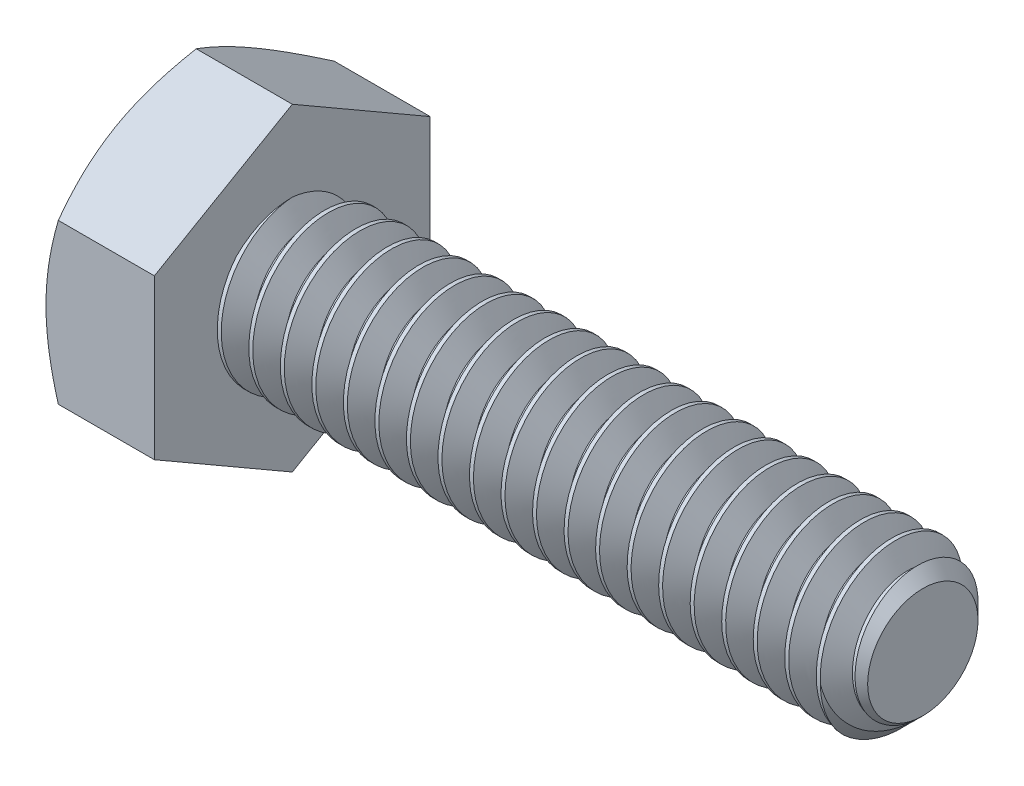
from build123d import *

# Parameters (mm, degrees)
SKETCH5_R           = 3.175
BOSS_EXTRUDE3_DEPTH = 25.4
CHAMFER1_SIZE       = 0.9525
CUT_SWEEP1_PITCH    = 1.27
BOSS_EXTRUDE4_DEPTH = 4.365625
SKETCH8_OUTSIDE_W   = 130.65
SKETCH8_OUTSIDE_H   = 132.37
SKETCH8_OUTSIDE_R   = 5.55625
CUT_EXTRUDE3_DEPTH  = 31.952009727
CUT_EXTRUDE3_DRAFT  = -60
CUT_EXTRUDE4_DEPTH  = 0.254
CIRPATTERN1_COUNT   = 6


with BuildPart() as part:
    # Sketch5 → Boss-Extrude3 (new body)
    with BuildSketch(Plane(origin=(14.8828125, 0, 0), x_dir=(0, 0, -1), z_dir=(1, 0, 0))):
        Circle(SKETCH5_R)
    extrude(amount=-BOSS_EXTRUDE3_DEPTH)

    # Chamfer1
    chamfer1_edges = [part.edges().sort_by_distance(p)[0] for p in [
        (14.8828125, 0, 3.175),
    ]]
    chamfer(chamfer1_edges, length=CHAMFER1_SIZE)

    # Cut-Sweep1: arcs per turn and ends read off the stored shape
    # Cut-Sweep1: the profile of Sketch10 profile screwed along a right-hand helix through 21 turns, 8 arcs to a turn; built about Z, then put on its axis
    cut_sweep1_z = Axis((0, 0, 0), (0, 0, 1))
    cut_sweep1_corners = [(3.1753, 0, 0.000173205), (2.350110803, 0, -0.47625), (2.350110803, 0, -0.635), (3.1753, 0, -1.111423205)]
    with BuildLine(mode=Mode.PRIVATE) as cut_sweep1_profile:
        Line(cut_sweep1_corners[0], cut_sweep1_corners[1])
        Line(cut_sweep1_corners[1], cut_sweep1_corners[2])
        Line(cut_sweep1_corners[2], cut_sweep1_corners[3])
        Line(cut_sweep1_corners[3], cut_sweep1_corners[0])
    cut_sweep1_cap = Face(cut_sweep1_profile.wire())
    cut_sweep1_turn_angles = [0, 22.5, 45, 67.5, 90, 112.5, 135, 157.5, 180, 202.5, 225, 247.5, 270, 292.5, 315, 337.5, 360]
    cut_sweep1_turn_weights = [1, 0.9238795325112867, 1, 0.9238795325112867, 1, 0.9238795325112867, 1, 0.9238795325112867, 1, 0.9238795325112867, 1, 0.9238795325112867, 1, 0.9238795325112867, 1, 0.9238795325112867, 1]
    cut_sweep1_turn_rails = [Edge.make_bspline([Vector(p[0], p[1], 0).rotate(cut_sweep1_z, cut_sweep1_turn_angles[k]) / cut_sweep1_turn_weights[k] + Vector(0, 0, p[2] + CUT_SWEEP1_PITCH * cut_sweep1_turn_angles[k] / 360) for k in range(17)], [0, 0, 0, 1, 1, 2, 2, 3, 3, 4, 4, 5, 5, 6, 6, 7, 7, 8, 8, 8], 2, cut_sweep1_turn_weights) for p in cut_sweep1_corners]
    cut_sweep1_turn_sides = [Face.make_surface_from_curves(cut_sweep1_turn_rails[p[0]], cut_sweep1_turn_rails[p[1]]) for p in [(0, 1), (1, 2), (2, 3), (3, 0)]]
    cut_sweep1 = Plane(origin=(14.8828125, 0, 0), x_dir=(0, 1, 0), z_dir=(-1, 0, 0)) * Solid(Shell([*[p.moved(Location((0, 0, CUT_SWEEP1_PITCH * i))) for i in range(21) for p in cut_sweep1_turn_sides], cut_sweep1_cap, cut_sweep1_cap.rotate(cut_sweep1_z, 7560).moved(Location((0, 0, CUT_SWEEP1_PITCH * 7560 / 360)))]))
    add(cut_sweep1, mode=Mode.SUBTRACT)

    # Sketch6 → Boss-Extrude4 (add)
    with BuildSketch(Plane.ZY.offset(10.5171875)):
        Polygon((5.55625, 3.207902433), (0, 6.415804866), (-5.55625, 3.207902433), (-5.55625, -3.207902433), (0, -6.415804866), (5.55625, -3.207902433), align=None)
    extrude(amount=BOSS_EXTRUDE4_DEPTH)


with BuildPart() as cut_extrude3_tool:
    # Sketch8 outside → Cut-Extrude3 (with draft: the straight prism first)
    with BuildSketch(Plane.ZY.offset(14.8828125)):
        Rectangle(SKETCH8_OUTSIDE_W, SKETCH8_OUTSIDE_H)
        Circle(SKETCH8_OUTSIDE_R, mode=Mode.SUBTRACT)
    extrude(amount=-CUT_EXTRUDE3_DEPTH)
    # Cut-Extrude3: the draft: its side faces are tilted about the plane it starts from
    cut_extrude3_sides = [cut_extrude3_tool.faces().sort_by_distance(p)[0] for p in [
        (1.093192363, -66.185, 0),
        (1.093192363, 0, 65.325),
        (1.093192363, 66.185, 0),
        (1.093192363, 0, -65.325),
        (1.093192363, 0, -5.55625),
    ]]
    draft(cut_extrude3_sides, Plane.ZY.offset(14.8828125), CUT_EXTRUDE3_DRAFT)


with BuildPart() as part_1:
    add(part.part)

    # Cut-Extrude3: cut by cut_extrude3_tool
    add(cut_extrude3_tool.part, mode=Mode.SUBTRACT)

    # Sketch12 → Cut-Extrude4 (cut)
    with BuildSketch(Plane.ZY.offset(14.8828125)):
        with BuildLine():
            Line((0.1666875, 4.2783125), (0.1666875, 2.3891875))
            ThreePointArc((0.1666875, 2.3891875), (0, 2.2225), (-0.1666875, 2.3891875))
            Line((-0.1666875, 2.3891875), (-0.1666875, 4.2783125))
            ThreePointArc((-0.1666875, 4.2783125), (0, 4.445), (0.1666875, 4.2783125))
        make_face()
    cut_extrude4 = extrude(amount=-CUT_EXTRUDE4_DEPTH, mode=Mode.SUBTRACT)

    # CirPattern1: Cut-Extrude4 ×6 about axis
    cirpattern1_axis = Axis((0, 0, 0), (1, 0, 0))
    for i in range(1, CIRPATTERN1_COUNT):
        add(cut_extrude4.rotate(cirpattern1_axis, i * 360 / CIRPATTERN1_COUNT), mode=Mode.SUBTRACT)


solid = part_1.part
